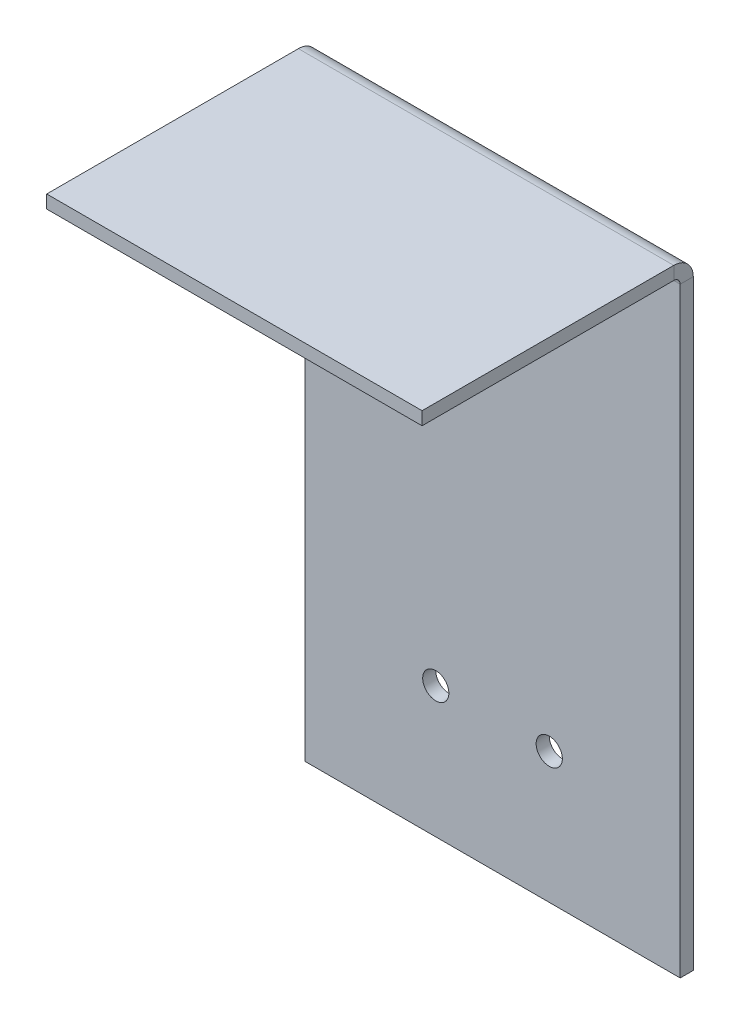
from build123d import *

# Parameters (mm, degrees)
SKETCH1_W              = 43
SKETCH1_H              = 100
BASE_FLANGE1_DEPTH     = 1.5
SKETCHED_BEND1_DEPTH   = 43
SKETCHED_BEND1_2_DEPTH = 43
F_3_0MM_DOWEL_HOLE1_D  = 3


# Read off the part's stored shape, not the designer's step: Sketched Bend1
# Sheet-metal steps are written as plain solids
with BuildPart() as part:
    # Sketch1 → Base-Flange1 (new body)
    with BuildSketch(Plane.XY):
        with Locations((21.5, 50)):
            Rectangle(SKETCH1_W, SKETCH1_H)
    extrude(amount=-BASE_FLANGE1_DEPTH)

    # Sketched Bend1 outline → Sketched Bend1 (cut)
    with BuildSketch(Plane.YZ):
        with BuildLine():
            Line((100, 0), (70.944250946, 0))
            ThreePointArc((70.944250946, 0), (70.127591172, -1.086838938), (68.83242709, -1.5))
            Line((68.83242709, -1.5), (100, -1.5))
            Line((100, -1.5), (100, 0))
        make_face()
    extrude(amount=SKETCHED_BEND1_DEPTH, mode=Mode.SUBTRACT)

    # Sketched Bend1 2 outline → Sketched Bend1 2 (add)
    with BuildSketch(Plane.YZ):
        with BuildLine():
            Line((69.56902709, 29.56902709), (69.56902709, 0.7366))
            ThreePointArc((69.56902709, 0.7366), (69.353281945, 0.215745145), (68.83242709, 0))
            Line((68.83242709, 0), (70.944250946, 0))
            ThreePointArc((70.944250946, 0), (71.037612433, 0.363053267), (71.06902709, 0.7366))
            Line((71.06902709, 0.7366), (71.06902709, 29.56902709))
            Line((71.06902709, 29.56902709), (69.56902709, 29.56902709))
        make_face()
    extrude(amount=SKETCHED_BEND1_2_DEPTH)

    # Ø3.0mm Dowel Hole1 (through all)
    with Locations(Plane(origin=(-21.797673733, -43.188016106, -1.5), x_dir=(-0.9396926207859104, 0.34202014332566333, 0), z_dir=(0, 0, -1))):
        with Locations((-26.893032931, 71.71065686), (-14.67702886, 67.264394997)):
            Hole(F_3_0MM_DOWEL_HOLE1_D / 2)


solid = part.part
